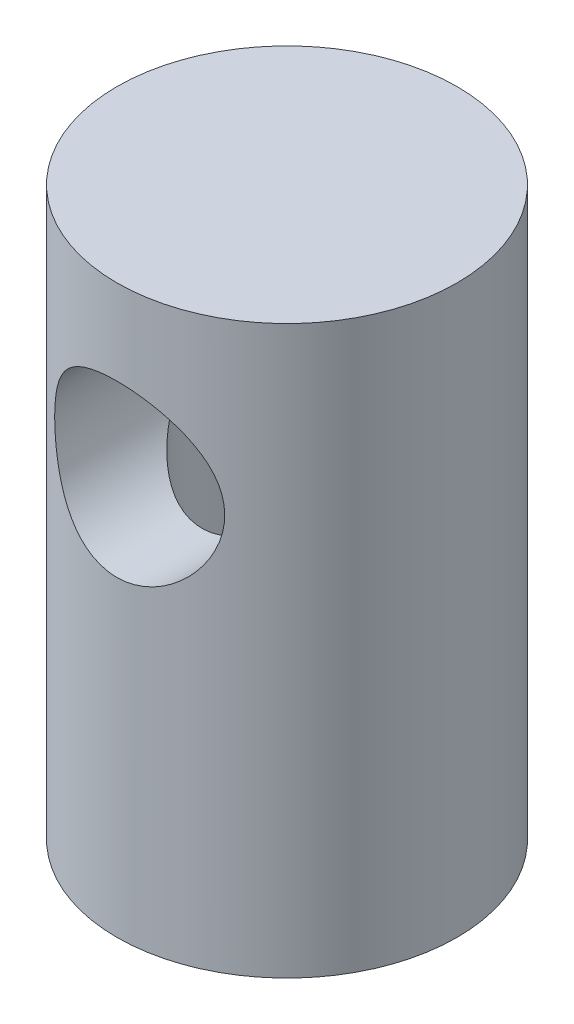
from build123d import *

# Parameters (mm, degrees)
SKETCH1_R                      = 3.81
BOSS_EXTRUDE1_DEPTH            = 12.7
CUT_EXTRUDE1_REACH             = 15.796
CUT_EXTRUDE1_END_RADIUS        = 3.81
SKETCH2_R                      = 1.905
CUT_EXTRUDE1_DIRECTION_2_DEPTH = 19.05
CUT_EXTRUDE2_REACH             = 15.796
CUT_EXTRUDE2_END_RADIUS        = 1.905
SKETCH3_R                      = 1.905


with BuildPart() as part:
    # Sketch1 → Boss-Extrude1 (new body)
    with BuildSketch(Plane(origin=(0, 0, 0), x_dir=(1, 0, 0), z_dir=(0, 1, 0))):
        Circle(SKETCH1_R)
    extrude(amount=BOSS_EXTRUDE1_DEPTH)

    # Cut-Extrude1: up to this cylinder (the profile starts inside it)
    cut_extrude1_end = Plane(origin=(0, 8.89, 0), z_dir=(0, -1, 0)) * Cylinder(CUT_EXTRUDE1_END_RADIUS, 40.212, mode=Mode.PRIVATE)
    # Sketch2 → Cut-Extrude1 (cut, up to the surface)
    with BuildSketch(Plane.XY, mode=Mode.PRIVATE) as cut_extrude1_sk1:
        with Locations((0, 8.89)):
            Circle(SKETCH2_R)
    cut_extrude1_tool1 = extrude(cut_extrude1_sk1.sketch, amount=-CUT_EXTRUDE1_REACH, mode=Mode.PRIVATE) & cut_extrude1_end
    add(cut_extrude1_tool1.solids().sort_by_distance((0, 8.89, 0))[0], mode=Mode.SUBTRACT)

    # Sketch2 → Cut-Extrude1 direction 2 (cut)
    with BuildSketch(Plane.XY):
        with Locations((0, 8.89)):
            Circle(SKETCH2_R)
    extrude(amount=CUT_EXTRUDE1_DIRECTION_2_DEPTH, mode=Mode.SUBTRACT)

    # Cut-Extrude2: up to this cylinder (the profile starts outside it)
    cut_extrude2_end = Plane(origin=(0, 8.89, 0), z_dir=(0, 0, -1)) * Cylinder(CUT_EXTRUDE2_END_RADIUS, 36.402, mode=Mode.PRIVATE)
    # Sketch3 → Cut-Extrude2 (cut, up to the surface)
    with BuildSketch(Plane.XZ, mode=Mode.PRIVATE) as cut_extrude2_sk1:
        Circle(SKETCH3_R)
    cut_extrude2_tool1 = extrude(cut_extrude2_sk1.sketch, amount=-CUT_EXTRUDE2_REACH, mode=Mode.PRIVATE) - cut_extrude2_end
    add(cut_extrude2_tool1.solids().sort_by_distance((0, 0, 0))[0], mode=Mode.SUBTRACT)


solid = part.part
